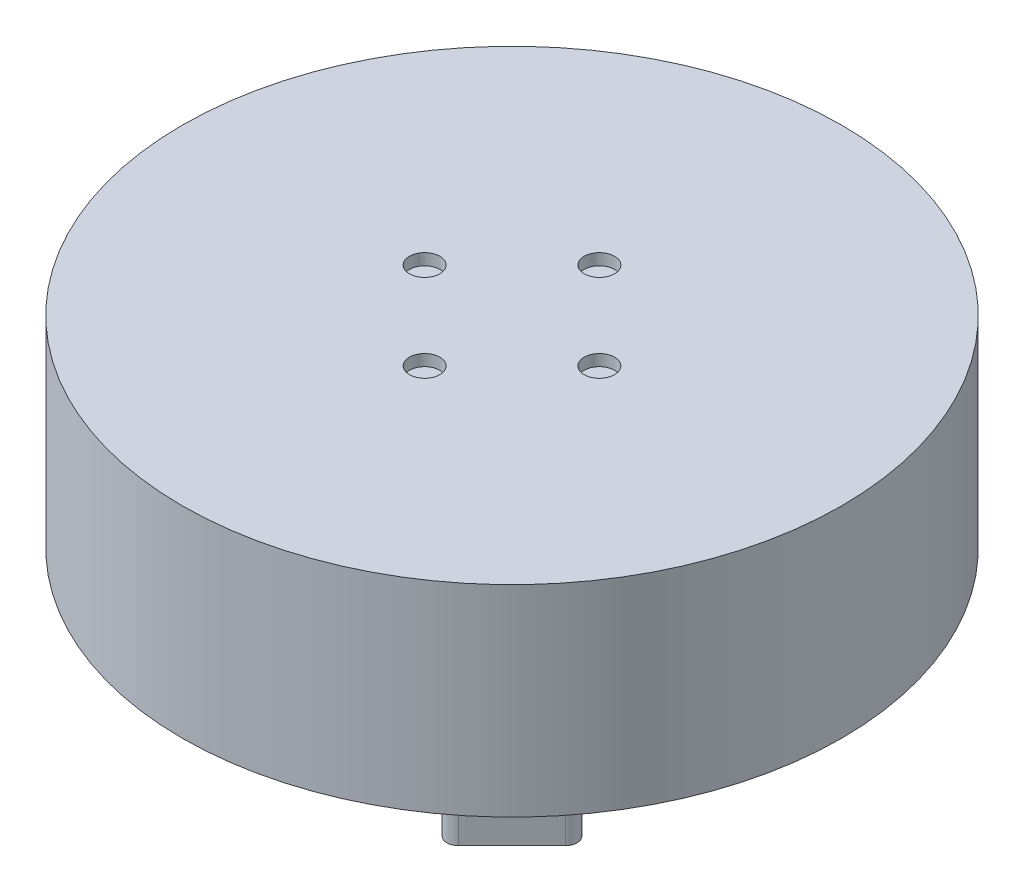
from build123d import *

# Parameters (mm, degrees)
SKETCH1_R           = 43.4
BOSS_EXTRUDE1_DEPTH = 26.5
SKETCH2_R           = 2
CUT_EXTRUDE1_DEPTH  = 1.5
BOSS_EXTRUDE2_DEPTH = 6
SKETCH4_R           = 2
CUT_EXTRUDE2_DEPTH  = 1.5


with BuildPart() as part:
    # Sketch1 → Boss-Extrude1 (new body)
    with BuildSketch(Plane(origin=(0, 0, 0), x_dir=(1, 0, 0), z_dir=(0, 1, 0))):
        Circle(SKETCH1_R)
    extrude(amount=BOSS_EXTRUDE1_DEPTH)

    # Sketch2 → Cut-Extrude1 (cut)
    with BuildSketch(Plane.XZ):
        with Locations((0, 16)):
            Circle(SKETCH2_R)
        with Locations((16, 0)):
            Circle(SKETCH2_R)
        with Locations((0, -16)):
            Circle(SKETCH2_R)
        with Locations((-16, 0)):
            Circle(SKETCH2_R)
    extrude(amount=-CUT_EXTRUDE1_DEPTH, mode=Mode.SUBTRACT)

    # Sketch3 → Boss-Extrude2 (add)
    with BuildSketch(Plane.XZ):
        with BuildLine():
            Line((24.395183951, 31.466251763), (31.466251763, 24.395183951))
            ThreePointArc((31.466251763, 24.395183951), (31.466251763, 22.273863607), (29.344931419, 22.273863607))
            Line((29.344931419, 22.273863607), (22.273863607, 29.344931419))
            ThreePointArc((22.273863607, 29.344931419), (22.273863607, 31.466251763), (24.395183951, 31.466251763))
        make_face()
    extrude(amount=BOSS_EXTRUDE2_DEPTH)

    # Sketch4 → Cut-Extrude2 (cut)
    with BuildSketch(Plane(origin=(0, 26.5, 0), x_dir=(1, 0, 0), z_dir=(0, 1, 0))):
        with Locations((0, 11.5)):
            Circle(SKETCH4_R)
        with Locations((11.5, 0)):
            Circle(SKETCH4_R)
        with Locations((0, -11.5)):
            Circle(SKETCH4_R)
        with Locations((-11.5, 0)):
            Circle(SKETCH4_R)
    extrude(amount=-CUT_EXTRUDE2_DEPTH, mode=Mode.SUBTRACT)


solid = part.part
